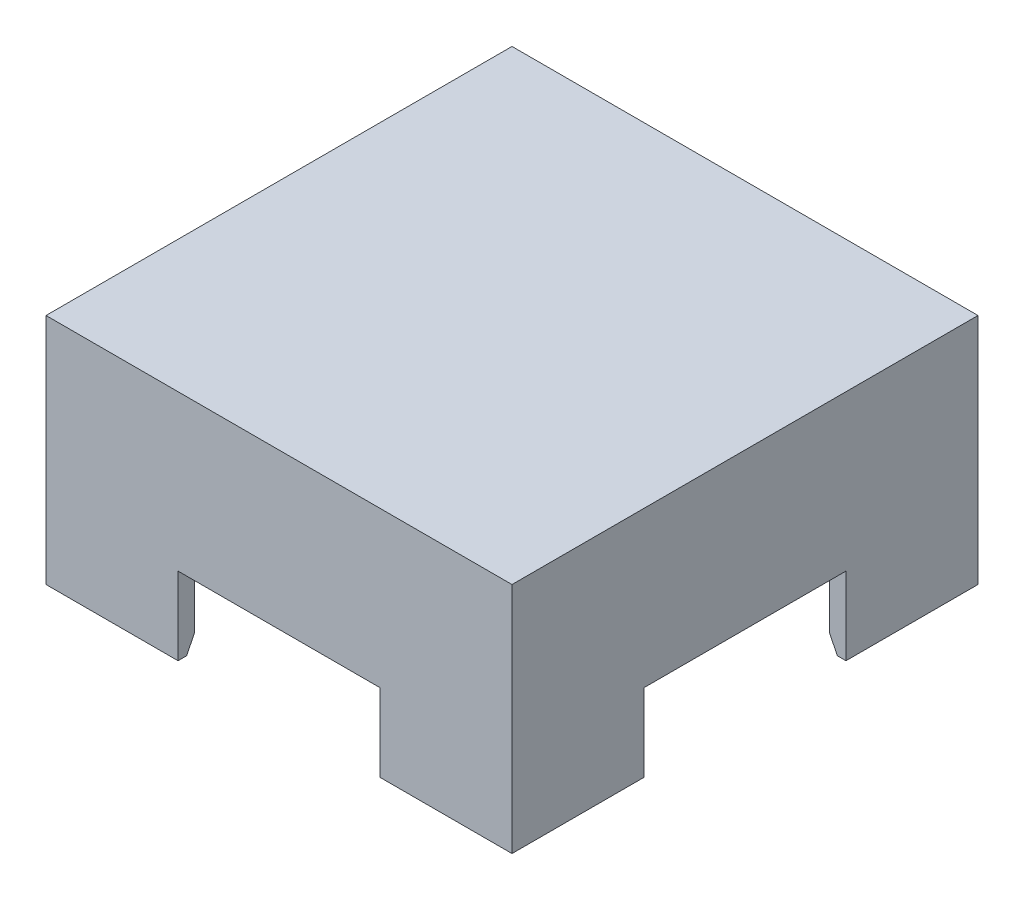
from build123d import *
from OCP.BRepFilletAPI import BRepFilletAPI_MakeChamfer

# Parameters (mm, degrees)
SKETCH1_W           = 76.2
SKETCH1_H           = 76.2
BOSS_EXTRUDE1_DEPTH = 25.4
SKETCH2_W           = 57.15
SKETCH2_H           = 57.15
CUT_EXTRUDE1_DEPTH  = 19.05
BOSS_EXTRUDE2_DEPTH = 12.7
CHAMFER1_SIZE       = 2.54
CHAMFER1_SIZE2      = 1.27


with BuildPart() as part:
    # Sketch1 → Boss-Extrude1 (new body)
    with BuildSketch(Plane(origin=(0, 1478.617106037, 0), x_dir=(1, 0, 0), z_dir=(0, 1, 0))):
        with Locations((-492.049198231, -806.92955637)):
            Rectangle(SKETCH1_W, SKETCH1_H)
    extrude(amount=BOSS_EXTRUDE1_DEPTH)

    # Sketch2 → Cut-Extrude1 (cut)
    with BuildSketch(Plane(origin=(0, 1478.617106037, 0), x_dir=(-1, 0, 0), z_dir=(0, -1, 0))):
        with Locations((492.049198231, -806.92955637)):
            Rectangle(SKETCH2_W, SKETCH2_H)
    extrude(amount=-CUT_EXTRUDE1_DEPTH, mode=Mode.SUBTRACT)

    # Sketch3 → Boss-Extrude2 (add)
    with BuildSketch(Plane(origin=(0, 1478.617106037, 0), x_dir=(-1, 0, 0), z_dir=(0, -1, 0))):
        Polygon((530.149198231, -790.41955637), (527.482198231, -790.41955637), (527.482198231, -771.49655637), (508.559198231, -771.49655637), (508.559198231, -768.82955637), (530.149198231, -768.82955637), align=None)
        Polygon((530.149198231, -823.43955637), (527.482198231, -823.43955637), (527.482198231, -842.36255637), (508.559198231, -842.36255637), (508.559198231, -845.02955637), (530.149198231, -845.02955637), align=None)
        Polygon((475.539198231, -768.82955637), (475.539198231, -771.49655637), (456.616198231, -771.49655637), (456.616198231, -790.41955637), (453.949198231, -790.41955637), (453.949198231, -768.82955637), align=None)
        Polygon((475.539198231, -845.02955637), (475.539198231, -842.36255637), (456.616198231, -842.36255637), (456.616198231, -823.43955637), (453.949198231, -823.43955637), (453.949198231, -845.02955637), align=None)
    extrude(amount=BOSS_EXTRUDE2_DEPTH)

    # Chamfer1: one chamfer whose edges measure the first distance from different faces: ONE call of the kernel's chamfer builder (chamfer() names one face for all edges)
    chamfer1_edges_1 = [part.edges().sort_by_distance(p)[0] for p in [
        (-527.482198231, 1465.917106037, 780.95805637),
    ]]
    chamfer1_side_1 = [part.faces().sort_by_distance(p)[0] for p in [
        (-527.482198231, 1472.267106037, 780.95805637),
    ]]
    chamfer1_edges_2 = [part.edges().sort_by_distance(p)[0] for p in [
        (-518.020698231, 1465.917106037, 771.49655637),
    ]]
    chamfer1_side_2 = [part.faces().sort_by_distance(p)[0] for p in [
        (-518.020698231, 1472.267106037, 771.49655637),
    ]]
    chamfer1_edges_3 = [part.edges().sort_by_distance(p)[0] for p in [
        (-466.077698231, 1465.917106037, 771.49655637),
    ]]
    chamfer1_side_3 = [part.faces().sort_by_distance(p)[0] for p in [
        (-466.077698231, 1472.267106037, 771.49655637),
    ]]
    chamfer1_edges_4 = [part.edges().sort_by_distance(p)[0] for p in [
        (-456.616198231, 1465.917106037, 780.95805637),
    ]]
    chamfer1_side_4 = [part.faces().sort_by_distance(p)[0] for p in [
        (-456.616198231, 1472.267106037, 780.95805637),
    ]]
    chamfer1_edges_5 = [part.edges().sort_by_distance(p)[0] for p in [
        (-456.616198231, 1465.917106037, 832.90105637),
    ]]
    chamfer1_side_5 = [part.faces().sort_by_distance(p)[0] for p in [
        (-456.616198231, 1472.267106037, 832.90105637),
    ]]
    chamfer1_edges_6 = [part.edges().sort_by_distance(p)[0] for p in [
        (-466.077698231, 1465.917106037, 842.36255637),
    ]]
    chamfer1_side_6 = [part.faces().sort_by_distance(p)[0] for p in [
        (-466.077698231, 1472.267106037, 842.36255637),
    ]]
    chamfer1_edges_7 = [part.edges().sort_by_distance(p)[0] for p in [
        (-527.482198231, 1465.917106037, 832.90105637),
    ]]
    chamfer1_side_7 = [part.faces().sort_by_distance(p)[0] for p in [
        (-527.482198231, 1472.267106037, 832.90105637),
    ]]
    chamfer1_edges_8 = [part.edges().sort_by_distance(p)[0] for p in [
        (-518.020698231, 1465.917106037, 842.36255637),
    ]]
    chamfer1_side_8 = [part.faces().sort_by_distance(p)[0] for p in [
        (-518.020698231, 1472.267106037, 842.36255637),
    ]]
    chamfer1 = BRepFilletAPI_MakeChamfer(part.part.solid().wrapped)
    for e in chamfer1_edges_1:
        chamfer1.Add(CHAMFER1_SIZE, CHAMFER1_SIZE2, e.wrapped, chamfer1_side_1[0].wrapped)  # the first distance lies on this face
    for e in chamfer1_edges_2:
        chamfer1.Add(CHAMFER1_SIZE, CHAMFER1_SIZE2, e.wrapped, chamfer1_side_2[0].wrapped)  # the first distance lies on this face
    for e in chamfer1_edges_3:
        chamfer1.Add(CHAMFER1_SIZE, CHAMFER1_SIZE2, e.wrapped, chamfer1_side_3[0].wrapped)  # the first distance lies on this face
    for e in chamfer1_edges_4:
        chamfer1.Add(CHAMFER1_SIZE, CHAMFER1_SIZE2, e.wrapped, chamfer1_side_4[0].wrapped)  # the first distance lies on this face
    for e in chamfer1_edges_5:
        chamfer1.Add(CHAMFER1_SIZE, CHAMFER1_SIZE2, e.wrapped, chamfer1_side_5[0].wrapped)  # the first distance lies on this face
    for e in chamfer1_edges_6:
        chamfer1.Add(CHAMFER1_SIZE, CHAMFER1_SIZE2, e.wrapped, chamfer1_side_6[0].wrapped)  # the first distance lies on this face
    for e in chamfer1_edges_7:
        chamfer1.Add(CHAMFER1_SIZE, CHAMFER1_SIZE2, e.wrapped, chamfer1_side_7[0].wrapped)  # the first distance lies on this face
    for e in chamfer1_edges_8:
        chamfer1.Add(CHAMFER1_SIZE, CHAMFER1_SIZE2, e.wrapped, chamfer1_side_8[0].wrapped)  # the first distance lies on this face
    add(Compound.cast(chamfer1.Shape()), mode=Mode.REPLACE)


solid = part.part
